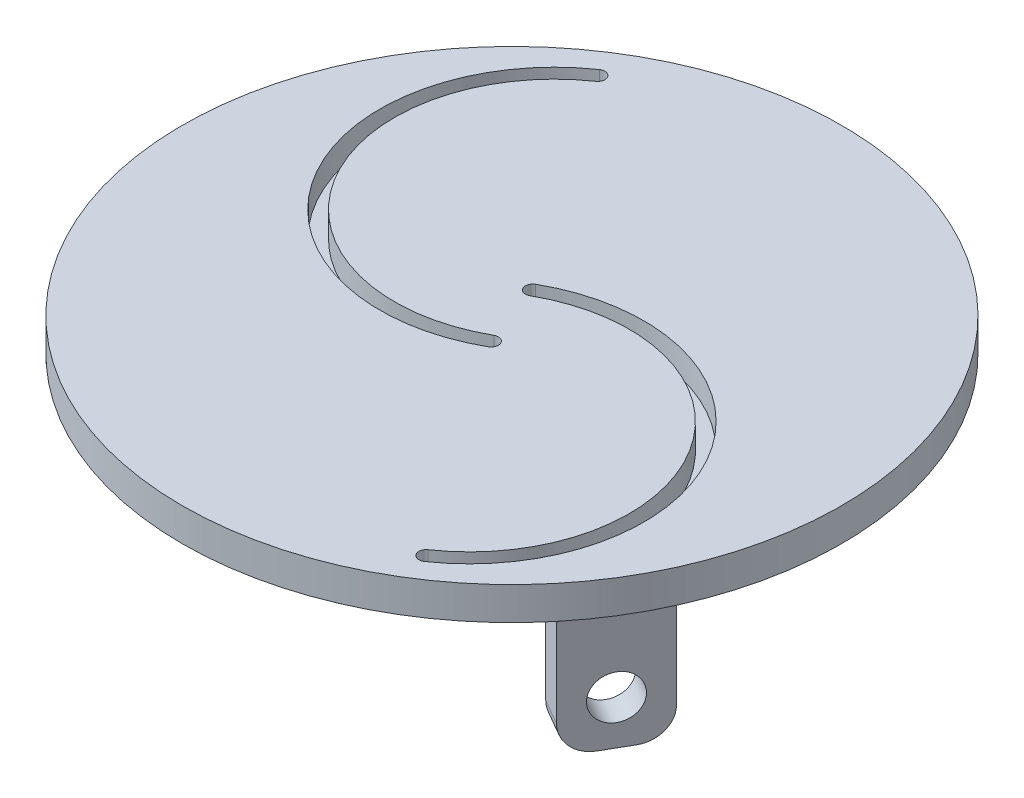
from build123d import *

# Parameters (mm, degrees)
SKETCH2_W                = 12
SKETCH2_H                = 4
BOSS_EXTRUDE2_DEPTH      = 20
SKETCH4_R                = 45
BOSS_EXTRUDE3_DEPTH      = 4.5
FILLET1_R                = 4
CUT_EXTRUDE1_REACH       = 100.393
SKETCH5_R                = 3
FILLET2_R                = 4
CIRPATTERN5_COUNT        = 3
FILLET1_OF_CIRPATTERN5_R = 4
FILLET2_OF_CIRPATTERN5_R = 4
CAVITY1_START            = 21
CAVITY1_DEPTH            = 3.5
CAVITY2_START            = 21
CAVITY2_DEPTH            = 3.5


# Read off the part's stored shape, not the designer's step: Cavity1, Cavity2
with BuildPart() as part:
    # Sketch2 → Boss-Extrude2 (new body)
    with BuildSketch(Plane(origin=(0, 0, 0), x_dir=(1, 0, 0), z_dir=(0, 1, 0))):
        with Locations((0, 30.848076211)):
            Rectangle(SKETCH2_W, SKETCH2_H)
    boss_extrude2 = extrude(amount=BOSS_EXTRUDE2_DEPTH)

    # Sketch4 → Boss-Extrude3 (add)
    with BuildSketch(Plane(origin=(0, 20, 0), x_dir=(1, 0, 0), z_dir=(0, 1, 0))):
        with Locations(Location((0, -6.151923789, 0), (0, 0, 270))):
            Circle(SKETCH4_R)
    extrude(amount=BOSS_EXTRUDE3_DEPTH)

    # Fillet1
    fillet1_edges = [part.edges().sort_by_distance(p)[0] for p in [
        (-6, 20, -30.848076211),
        (6, 20, -30.848076211),
        (0, 20, -32.848076211),
    ]]
    fillet(fillet1_edges, radius=FILLET1_R)

    # Sketch5 → Cut-Extrude1 (cut, up to next)
    with BuildSketch(Plane(origin=(0, 0, -32.848076211), x_dir=(-1, 0, 0), z_dir=(0, 0, -1)), mode=Mode.PRIVATE) as cut_extrude1_sk1:
        with Locations((0, 6)):
            Circle(SKETCH5_R)
    cut_extrude1_tool1 = extrude(cut_extrude1_sk1.sketch, amount=-CUT_EXTRUDE1_REACH, mode=Mode.PRIVATE) & part.part
    cut_extrude1 = cut_extrude1_tool1.solids().sort_by_distance((0, 6, -32.848076))[0]
    add(cut_extrude1, mode=Mode.SUBTRACT)

    # Fillet2
    fillet2_edges = [part.edges().sort_by_distance(p)[0] for p in [
        (-6, 0, -30.848076211),
        (6, 0, -30.848076211),
    ]]
    fillet(fillet2_edges, radius=FILLET2_R)

    # CirPattern5: Boss-Extrude2, Cut-Extrude1 ×3 about axis
    cirpattern5_axis = Axis((0, 0, 6.151923789), (0, 1, 0))
    add([boss_extrude2.rotate(cirpattern5_axis, i * 360 / CIRPATTERN5_COUNT) for i in range(1, CIRPATTERN5_COUNT)])
    add([cut_extrude1.rotate(cirpattern5_axis, i * 360 / CIRPATTERN5_COUNT) for i in range(1, CIRPATTERN5_COUNT)], mode=Mode.SUBTRACT)

    # Fillet1 of CirPattern5
    fillet1_of_cirpattern5_edges = [part.edges().sort_by_distance(p)[0] for p in [
        (-29.04293994, 20, 29.848076211),
        (-35.04293994, 20, 19.455771366),
        (-33.774990748, 20, 25.651923789),
        (35.04293994, 20, 19.455771366),
        (29.04293994, 20, 29.848076211),
        (33.774990748, 20, 25.651923789),
    ]]
    fillet(fillet1_of_cirpattern5_edges, radius=FILLET1_OF_CIRPATTERN5_R)

    # Fillet2 of CirPattern5
    fillet2_of_cirpattern5_edges = [part.edges().sort_by_distance(p)[0] for p in [
        (-29.04293994, 0, 29.848076211),
        (-35.04293994, 0, 19.455771366),
        (35.04293994, 0, 19.455771366),
        (29.04293994, 0, 29.848076211),
    ]]
    fillet(fillet2_of_cirpattern5_edges, radius=FILLET2_OF_CIRPATTERN5_R)

    # Cavity1 outline → Cavity1 (cut)
    with BuildSketch(Plane(origin=(0, 0, 0), x_dir=(1, 0, 0), z_dir=(0, 1, 0)).offset(CAVITY1_START)):
        with BuildLine():
            ThreePointArc((2.442725539, -10.067144534), (1.841235151, -9.627440673), (1.102669127, -9.725677123))
            ThreePointArc((1.102669127, -9.725677123), (-28.135128354, -2.275427339), (-21.973365635, 27.260782702))
            ThreePointArc((-21.973365635, 27.260782702), (-21.560444182, 27.88096497), (-21.690953471, 28.614516261))
            ThreePointArc((-21.690953471, 28.614516261), (-22.33514846, 29.064110473), (-23.10537251, 28.909588462))
            ThreePointArc((-23.10537251, 28.909588462), (-29.831959556, -3.334088698), (2.085950749, -11.467273303))
            ThreePointArc((2.085950749, -11.467273303), (2.563344478, -10.843400426), (2.442725539, -10.067144534))
        make_face()
    extrude(amount=CAVITY1_DEPTH, mode=Mode.SUBTRACT)

    # Cavity2 outline → Cavity2 (cut)
    with BuildSketch(Plane(origin=(0, 0, 0), x_dir=(1, 0, 0), z_dir=(0, 1, 0)).offset(CAVITY2_START)):
        with BuildLine():
            ThreePointArc((-2.442725539, -2.236703043), (-1.841235151, -2.676406904), (-1.102669127, -2.578170454))
            ThreePointArc((-1.102669127, -2.578170454), (28.135128354, -10.028420238), (21.973365635, -39.564630279))
            ThreePointArc((21.973365635, -39.564630279), (21.560444182, -40.184812547), (21.690953471, -40.918363839))
            ThreePointArc((21.690953471, -40.918363839), (22.33514846, -41.36795805), (23.10537251, -41.213436039))
            ThreePointArc((23.10537251, -41.213436039), (29.831959556, -8.96975888), (-2.085950749, -0.836574274))
            ThreePointArc((-2.085950749, -0.836574274), (-2.563344478, -1.460447151), (-2.442725539, -2.236703043))
        make_face()
    extrude(amount=CAVITY2_DEPTH, mode=Mode.SUBTRACT)


solid = part.part
